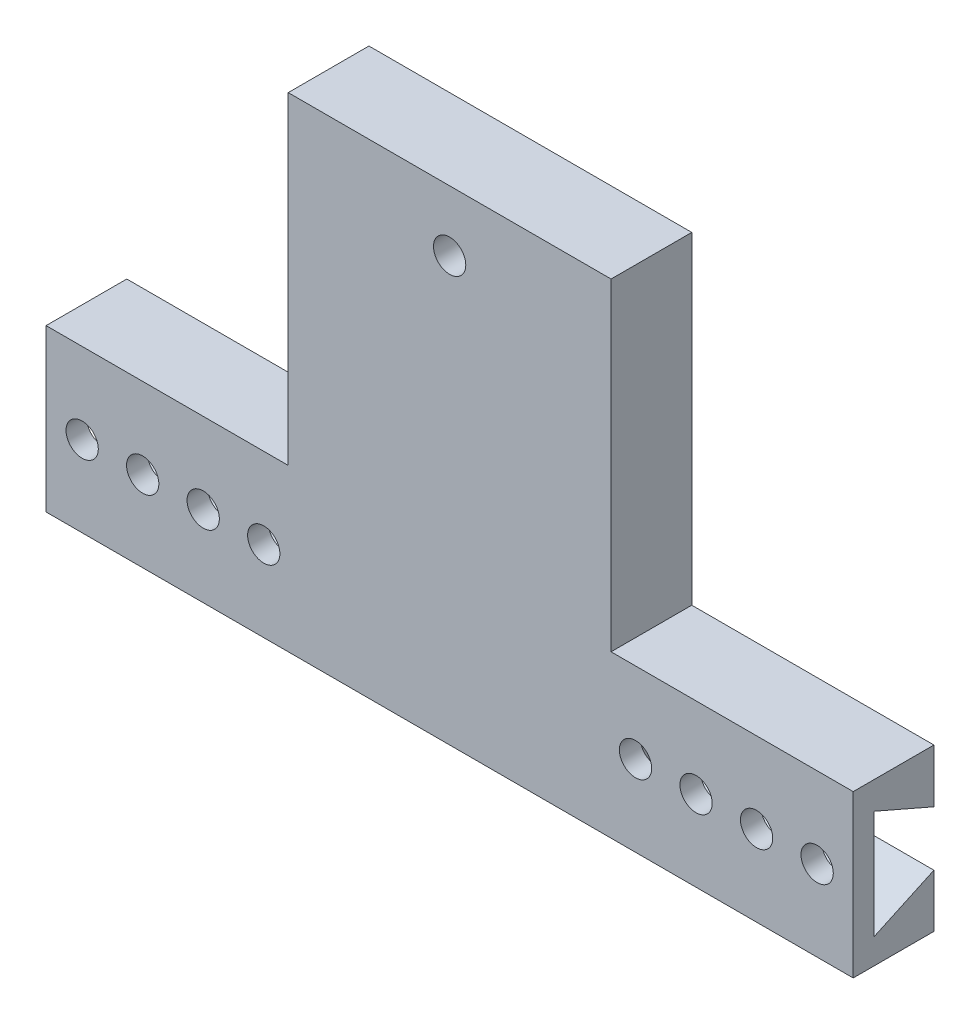
from build123d import *

# Parameters (mm, degrees)
SKETCH1_W               = 40
SKETCH1_H               = 10
BOSS_EXTRUDE1_DEPTH     = 60
SKETCH2_W               = 10
SKETCH2_H               = 20
BOSS_EXTRUDE2_DEPTH     = 30
CUT_EXTRUDE1_DEPTH      = 30
SKETCH6_R               = 2
CUT_EXTRUDE2_DEPTH      = 79.74007874
LPATTERN1_COUNT         = 4
LPATTERN1_PITCH         = 7.5
MIRROR3_COPY_1_SKETCH_R = 2
MIRROR3_COPY_1_DEPTH    = 79.74007874
MIRROR3_COPY_2_SKETCH_R = 2
MIRROR3_COPY_2_DEPTH    = 79.74007874
MIRROR3_COPY_3_SKETCH_R = 2
MIRROR3_COPY_3_DEPTH    = 79.74007874
MIRROR3_COPY_4_SKETCH_R = 2
MIRROR3_COPY_4_DEPTH    = 79.74007874
SKETCH7_R               = 2
CUT_EXTRUDE3_DEPTH      = 30


with BuildPart() as part:
    # Sketch1 → Boss-Extrude1 (new body)
    with BuildSketch(Plane(origin=(0, 0, 0), x_dir=(1, 0, 0), z_dir=(0, 1, 0))):
        Rectangle(SKETCH1_W, SKETCH1_H)
    extrude(amount=-BOSS_EXTRUDE1_DEPTH)

    # Sketch2 → Boss-Extrude2 (add)
    with BuildSketch(Plane(origin=(20, 0, 0), x_dir=(0, 0, -1), z_dir=(1, 0, 0))):
        with Locations((0, -50)):
            Rectangle(SKETCH2_W, SKETCH2_H)
    boss_extrude2 = extrude(amount=BOSS_EXTRUDE2_DEPTH)

    # Sketch3 → Cut-Extrude1 (cut)
    with BuildSketch(Plane(origin=(50, 0, 0), x_dir=(0, 0, -1), z_dir=(1, 0, 0))):
        Polygon((-2.424511303, -50.399754432), (-2.424511303, -56.86445113), (5, -53.432225565), (5, -46.632102781), (-2.424511303, -43.399754432), align=None)
    cut_extrude1 = extrude(amount=-CUT_EXTRUDE1_DEPTH, mode=Mode.SUBTRACT)

    # Sketch6 → Cut-Extrude2 (cut, through all)
    with BuildSketch(Plane.XY.offset(5)):
        with Locations((45.53043355, -50)):
            Circle(SKETCH6_R)
    cut_extrude2 = extrude(amount=-CUT_EXTRUDE2_DEPTH, mode=Mode.SUBTRACT)

    # LPattern1: Cut-Extrude2 ×4
    with Locations(*[(-i * LPATTERN1_PITCH, 0, 0) for i in range(1, LPATTERN1_COUNT)]):
        add(cut_extrude2, mode=Mode.SUBTRACT)

    # Mirror3: Boss-Extrude2, Cut-Extrude1 across plane
    add(boss_extrude2.mirror(Plane(origin=(0, 0, 0), x_dir=(0, 0, 1), z_dir=(1, 0, 0))))
    add(cut_extrude1.mirror(Plane(origin=(0, 0, 0), x_dir=(0, 0, 1), z_dir=(1, 0, 0))), mode=Mode.SUBTRACT)

    # Mirror3 copy 1 sketch → Mirror3 copy 1 (cut, through all)
    with BuildSketch(Plane(origin=(7.5, 0, 5), x_dir=(-1, 0, 0), z_dir=(0, 0, 1))):
        with Locations((45.53043355, 50)):
            Circle(MIRROR3_COPY_1_SKETCH_R)
    extrude(amount=-MIRROR3_COPY_1_DEPTH, mode=Mode.SUBTRACT)

    # Mirror3 copy 2 sketch → Mirror3 copy 2 (cut, through all)
    with BuildSketch(Plane(origin=(15, 0, 5), x_dir=(-1, 0, 0), z_dir=(0, 0, 1))):
        with Locations((45.53043355, 50)):
            Circle(MIRROR3_COPY_2_SKETCH_R)
    extrude(amount=-MIRROR3_COPY_2_DEPTH, mode=Mode.SUBTRACT)

    # Mirror3 copy 3 sketch → Mirror3 copy 3 (cut, through all)
    with BuildSketch(Plane(origin=(22.5, 0, 5), x_dir=(-1, 0, 0), z_dir=(0, 0, 1))):
        with Locations((45.53043355, 50)):
            Circle(MIRROR3_COPY_3_SKETCH_R)
    extrude(amount=-MIRROR3_COPY_3_DEPTH, mode=Mode.SUBTRACT)

    # Mirror3 copy 4 sketch → Mirror3 copy 4 (cut, through all)
    with BuildSketch(Plane(origin=(0, 0, 5), x_dir=(-1, 0, 0), z_dir=(0, 0, 1))):
        with Locations((45.53043355, 50)):
            Circle(MIRROR3_COPY_4_SKETCH_R)
    extrude(amount=-MIRROR3_COPY_4_DEPTH, mode=Mode.SUBTRACT)

    # Sketch7 → Cut-Extrude3 (cut)
    with BuildSketch(Plane.XY.offset(5)):
        with Locations((0, -7.5)):
            Circle(SKETCH7_R)
    extrude(amount=-CUT_EXTRUDE3_DEPTH, mode=Mode.SUBTRACT)


solid = part.part
